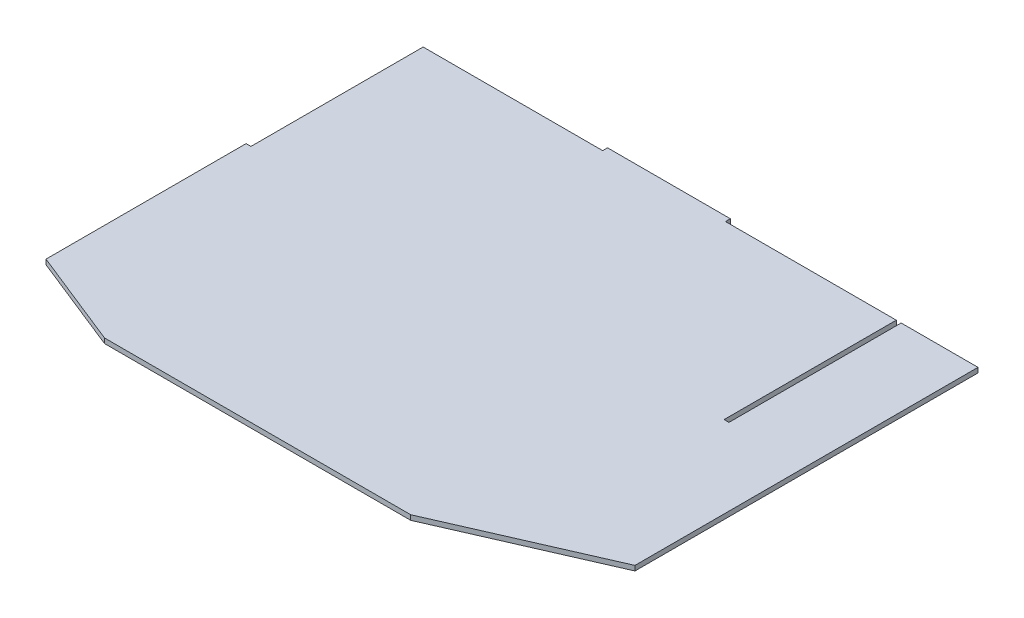
from build123d import *

# Parameters (mm, degrees)
SKETCH1_W           = 308.102
SKETCH1_H           = 3.175
BOSS_EXTRUDE1_DEPTH = 267.83
SKETCH3_W           = 155.702
SKETCH3_H           = 3.175
BOSS_EXTRUDE3_DEPTH = 3.175
SKETCH4_W           = 50.038
SKETCH4_H           = 3.175
BOSS_EXTRUDE4_DEPTH = 267.83
CUT_EXTRUDE1_DEPTH  = 339.675885207
CUT_EXTRUDE2_DEPTH  = 339.675885207
SKETCH8_W           = 80
SKETCH8_H           = 3.175
BOSS_EXTRUDE6_DEPTH = 3.175


with BuildPart() as part:
    # Sketch1 → Boss-Extrude1 (new body)
    with BuildSketch(Plane.XY):
        Rectangle(SKETCH1_W, SKETCH1_H)
    extrude(amount=BOSS_EXTRUDE1_DEPTH)

    # Sketch3 → Boss-Extrude3 (add)
    with BuildSketch(Plane(origin=(154.051, 0, 0), x_dir=(0, 0, -1), z_dir=(1, 0, 0))):
        with Locations((-189.979, 0)):
            Rectangle(SKETCH3_W, SKETCH3_H)
    boss_extrude3 = extrude(amount=BOSS_EXTRUDE3_DEPTH)

    # Mirror1: Boss-Extrude3 across plane
    add(boss_extrude3.mirror(Plane(origin=(0, 0, 0), x_dir=(0, 0, 1), z_dir=(1, 0, 0))))

    # Sketch4 → Boss-Extrude4 (add)
    with BuildSketch(Plane.XY.offset(267.83)):
        with Locations((182.245, 0)):
            Rectangle(SKETCH4_W, SKETCH4_H)
    extrude(amount=-BOSS_EXTRUDE4_DEPTH)

    # Sketch6 → Cut-Extrude1 (cut, through all)
    with BuildSketch(Plane(origin=(0, 1.5875, 0), x_dir=(1, 0, 0), z_dir=(0, 1, 0))):
        Polygon((207.264, -223.38), (105.664, -267.83), (207.264, -267.83), align=None)
    extrude(amount=-CUT_EXTRUDE1_DEPTH, mode=Mode.SUBTRACT)

    # Sketch7 → Cut-Extrude2 (cut, through all)
    with BuildSketch(Plane.XZ.offset(1.5875)):
        Polygon((-157.226, 242.43), (-93.726, 267.83), (-157.226, 267.83), align=None)
    extrude(amount=-CUT_EXTRUDE2_DEPTH, mode=Mode.SUBTRACT)

    # Sketch8 → Boss-Extrude6 (add)
    with BuildSketch(Plane(origin=(0, 0, 0), x_dir=(-1, 0, 0), z_dir=(0, 0, -1))):
        with Locations((-2.83099998, -1e-09)):
            Rectangle(SKETCH8_W, SKETCH8_H)
    extrude(amount=BOSS_EXTRUDE6_DEPTH)


solid = part.part
